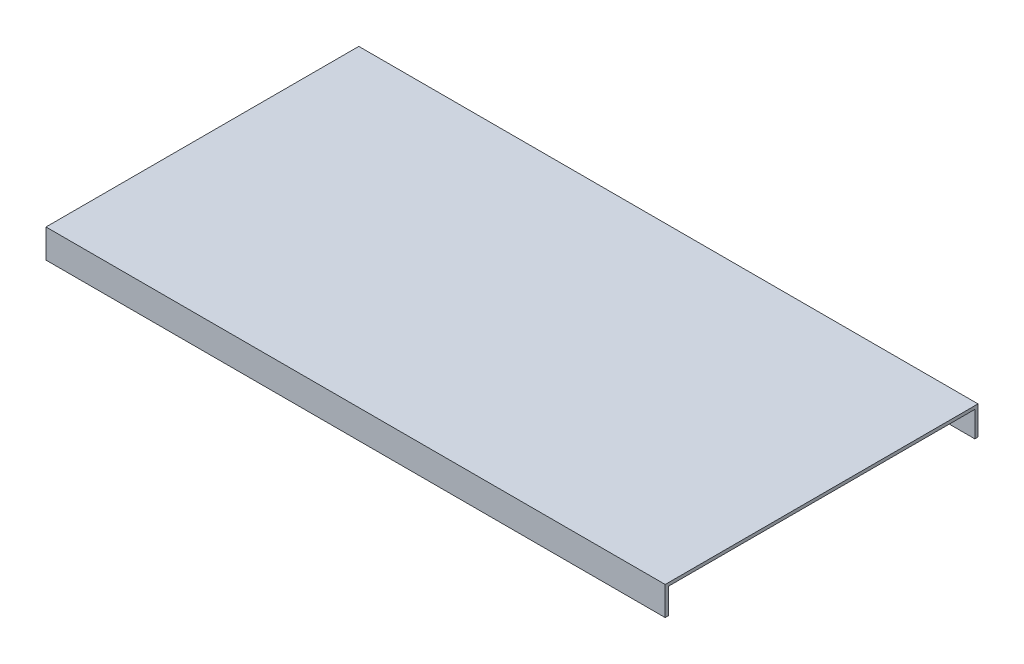
from build123d import *

# Parameters (mm, degrees)
SKETCH1_W           = 307.975
SKETCH1_H           = 155.575
BOSS_EXTRUDE1_DEPTH = 1.5875
BOSS_EXTRUDE2_DEPTH = 12.7


with BuildPart() as part:
    # Sketch1 → Boss-Extrude1 (new body)
    with BuildSketch(Plane(origin=(0, 0, 0), x_dir=(1, 0, 0), z_dir=(0, 1, 0))):
        Rectangle(SKETCH1_W, SKETCH1_H)
    extrude(amount=BOSS_EXTRUDE1_DEPTH)

    # Sketch2 → Boss-Extrude2 (add)
    with BuildSketch(Plane.XZ):
        Polygon((-152.4, 76.2), (152.4, 76.2), (153.9875, 76.2), (153.9875, 77.7875), (-153.9875, 77.7875), (-153.9875, -77.7875), (153.9875, -77.7875), (153.9875, -76.2), (152.4, -76.2), (-152.4, -76.2), align=None)
    extrude(amount=BOSS_EXTRUDE2_DEPTH)


solid = part.part
